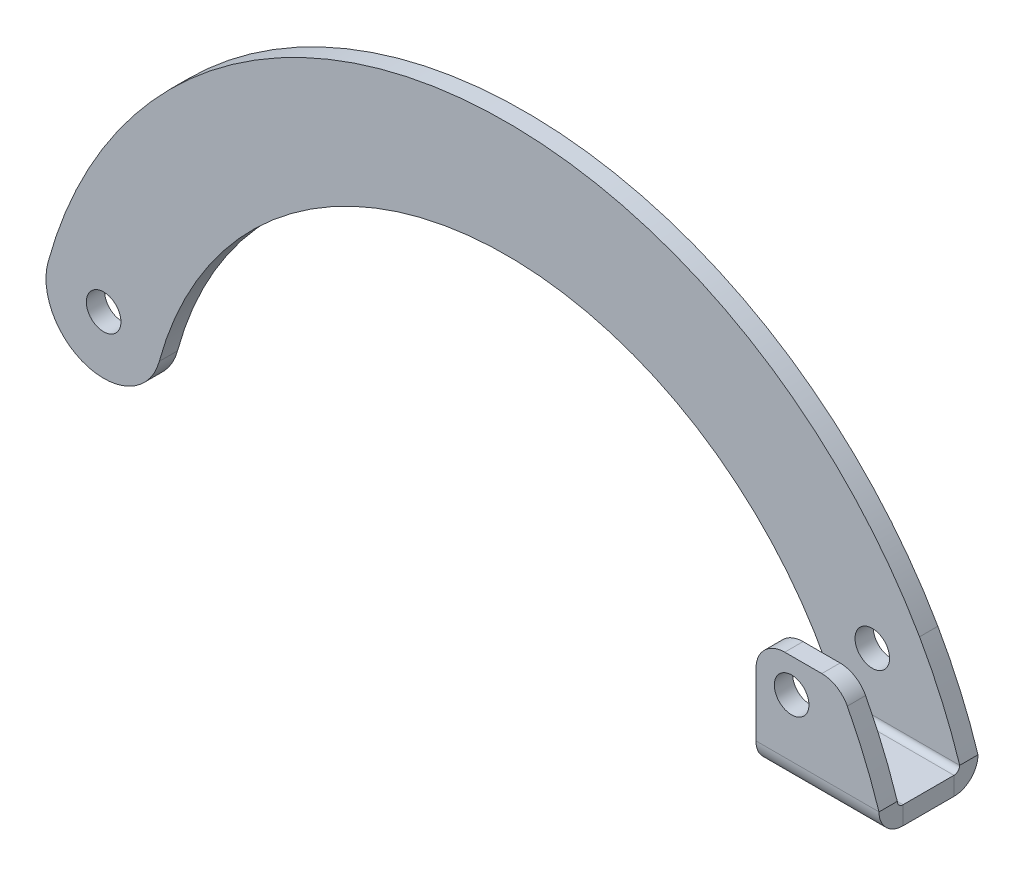
from build123d import *

# Parameters (mm, degrees)
BASE_FLANGE1_DEPTH           = 3.175
EDGE_FLANGE1_DEPTH           = 21.356037378
EDGE_FLANGE2_STRIP_W         = 14.7
EDGE_FLANGE2_STRIP_H         = 3.175
EDGE_FLANGE2_STRIP_CUT_DEPTH = 21.356037378
EDGE_FLANGE2_DEPTH           = 21.356037378
CUT_EXTRUDE1_DEPTH           = 160.658100285
CUT_EXTRUDE1_DEPTH_BACK      = 160.658100285
SKETCH12_R                   = 3
FILLET1_R                    = 5


# Sheet-metal steps are written as plain solids
with BuildPart() as part:
    # Sketch1 → Base-Flange1 (new body)
    with BuildSketch(Plane.XY):
        with BuildLine():
            Line((127.178904259, -0.503108866), (143.372130178, -0.503108866))
            Line((143.372130178, -0.503108866), (148.534941637, -0.503108866))
            ThreePointArc((148.534941637, -0.503108866), (146.210001092, 5.851436917), (143.372130178, 11.994082058))
            ThreePointArc((143.372130178, 11.994082058), (61.381820352, 56.404158269), (-9.649714749, -4.004341098))
            ThreePointArc((-9.649714749, -4.004341098), (-2.623548221, -16.277604067), (9.649714749, -9.251437539))
            ThreePointArc((9.649714749, -9.251437539), (65.321056088, 36.678957766), (127.178904259, -0.503108866))
        make_face()
    extrude(amount=-BASE_FLANGE1_DEPTH)

    # Edge-Flange1 section (across the edge) → Edge-Flange1 (add)
    with BuildSketch(Plane(origin=(127.178904259, -1.503108866, 0), x_dir=(0, 1, 0), z_dir=(1, 0, 0))):
        with BuildLine():
            Line((-3.175, 1), (-3.175, 10.825))
            Line((-3.175, 10.825), (0, 10.825))
            Line((0, 10.825), (0, 1))
            ThreePointArc((0, 1), (0.292893219, 0.292893219), (1, 0))
            Line((1, 0), (1, -3.175))
            ThreePointArc((1, -3.175), (-1.952170811, -1.952170811), (-3.175, 1))
        make_face()
    extrude(amount=EDGE_FLANGE1_DEPTH)

    # Edge-Flange2 strip (across the edge) → Edge-Flange2 strip cut (cut)
    with BuildSketch(Plane(origin=(127.178904259, -1.503108866, 10.825), x_dir=(0, 0, -1), z_dir=(1, 0, 0))):
        with Locations((-6.35, -1.5875)):
            Rectangle(EDGE_FLANGE2_STRIP_W, EDGE_FLANGE2_STRIP_H)
    extrude(amount=EDGE_FLANGE2_STRIP_CUT_DEPTH, mode=Mode.SUBTRACT)

    # Edge-Flange2 section (across the edge) → Edge-Flange2 (add)
    with BuildSketch(Plane(origin=(127.178904259, -1.503108866, 10.825), x_dir=(0, 0, -1), z_dir=(1, 0, 0))):
        with BuildLine():
            Line((-3.175, 1), (-3.175, 16.825))
            Line((-3.175, 16.825), (0, 16.825))
            Line((0, 16.825), (0, 1))
            ThreePointArc((0, 1), (0.292893219, 0.292893219), (1, 0))
            Line((1, 0), (1, -3.175))
            ThreePointArc((1, -3.175), (-1.952170811, -1.952170811), (-3.175, 1))
        make_face()
    extrude(amount=EDGE_FLANGE2_DEPTH)

    # Sketch12 → Cut-Extrude1 (cut, two sides: drawn at the far end of the back side and taken through both)
    with BuildSketch(Plane.XY.offset(-CUT_EXTRUDE1_DEPTH_BACK)):
        with Locations((133.372130178, 9.496891134)):
            Circle(SKETCH12_R)
        with Locations((0, -6.627889318)):
            Circle(SKETCH12_R)
        with BuildLine():
            Line((141.568166958, 15.321891134), (148.534941637, 15.321891134))
            Line((148.534941637, 15.321891134), (148.534941637, -0.503108866))
            ThreePointArc((148.534941637, -0.503108866), (146.210001092, 5.851436917), (143.372130178, 11.994082058))
            ThreePointArc((143.372130178, 11.994082058), (142.48923714, 13.66833427), (141.568166958, 15.321891134))
        make_face()
    extrude(amount=CUT_EXTRUDE1_DEPTH + CUT_EXTRUDE1_DEPTH_BACK, mode=Mode.SUBTRACT)

    # Fillet1
    fillet1_edges = [part.edges().sort_by_distance(p)[0] for p in [
        (127.178904259, 15.321891134, 12.4125),
        (141.568166958, 15.321891134, 12.4125),
    ]]
    fillet(fillet1_edges, radius=FILLET1_R)


solid = part.part
